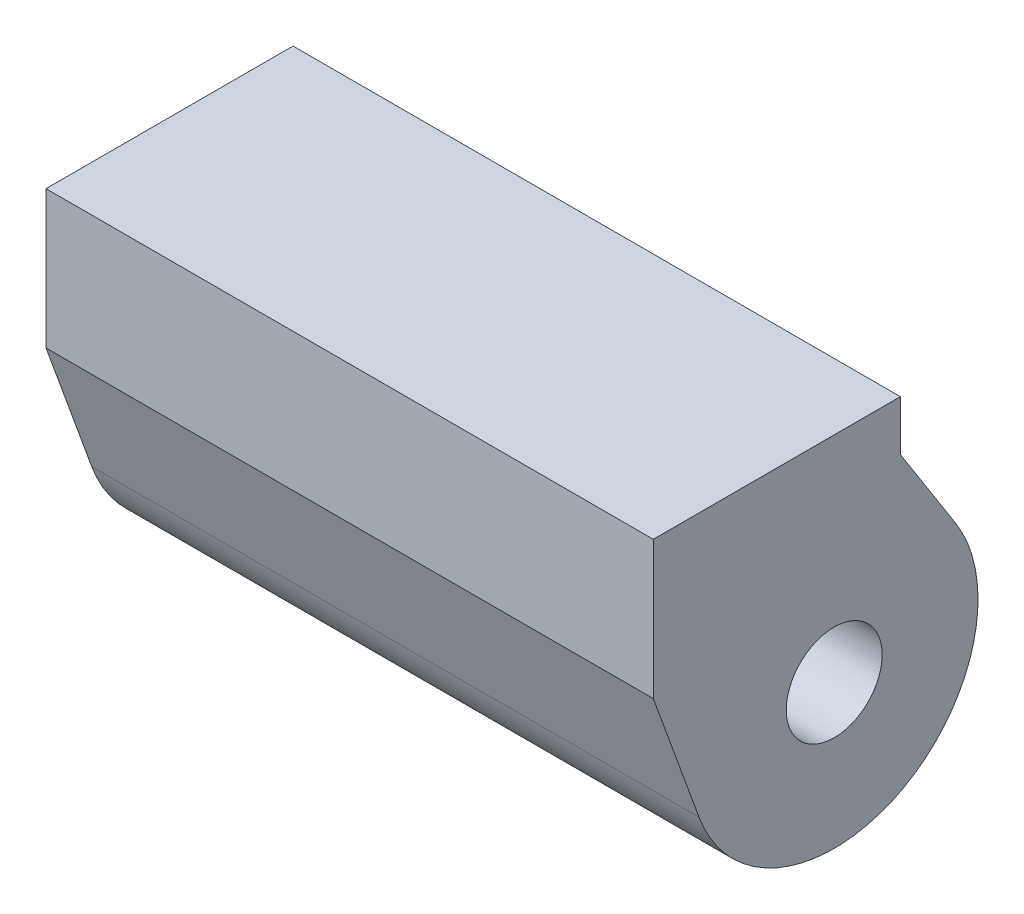
from build123d import *

# Parameters (mm, degrees)
BOSS_EXTRUDE1_START       = -0.8
BOSS_EXTRUDE1_OUTLINE_R   = 6
BOSS_EXTRUDE1_OUTLINE_R_2 = 2.5
BOSS_EXTRUDE1_DEPTH       = 1
BOSS_EXTRUDE1_START_2     = -9.5
BOSS_EXTRUDE1_2_OUTLINE_R = 2.75
BOSS_EXTRUDE1_2_DEPTH     = 19
BOSS_EXTRUDE1_START_3     = 20.214309477
BOSS_EXTRUDE1_3_OUTLINE_R = 1.25
BOSS_EXTRUDE1_3_DEPTH     = 5
SKETCH2_R                 = 6.25
CUT_EXTRUDE1_DEPTH        = 36.290497761
SKETCH3_R                 = 1.5
CUT_EXTRUDE2_DEPTH        = 10
SKETCH4_R                 = 2.75
SKETCH4_R_2               = 1.5
BOSS_EXTRUDE2_DEPTH       = 19
SKETCH5_W                 = 25.593794746
SKETCH5_H                 = 54.341869273
CUT_EXTRUDE3_DEPTH        = 45.112349032
SKETCH6_W                 = 19
SKETCH6_H                 = 8.728279904
BOSS_EXTRUDE3_DEPTH       = 1.568762114
SKETCH7_W                 = 4.505283746
SKETCH7_H                 = 5.968681608
CUT_EXTRUDE4_DEPTH        = 40.377309908


with BuildPart() as part:
    # Boss-Extrude1: read off the stored shape, not the designer's step
    # Boss-Extrude1 outline → Boss-Extrude1 (new body)
    with BuildSketch(Plane(origin=(0, 0, 24.414309477), x_dir=(-1, 0, 0), z_dir=(0, 0, -1)).offset(BOSS_EXTRUDE1_START)):
        with Locations((0, 13.101553709)):
            Circle(BOSS_EXTRUDE1_OUTLINE_R)
        with Locations((0, 13.101553709)):
            Circle(BOSS_EXTRUDE1_OUTLINE_R_2, mode=Mode.SUBTRACT)
    extrude(amount=BOSS_EXTRUDE1_DEPTH)

    # Boss-Extrude1 2 outline → Boss-Extrude1 2 (add)
    with BuildSketch(Plane.YZ.offset(BOSS_EXTRUDE1_START_2)):
        with BuildLine():
            Line((30.808082296, 25.214309477), (-4.594884555, 25.214309477))
            ThreePointArc((-4.594884555, 25.214309477), (-6.157718154, 25.077579254), (-7.673065845, 24.671543064))
            Line((-7.673065845, 24.671543064), (-24.384342131, 18.58913592))
            ThreePointArc((-24.384342131, 18.58913592), (-26.882991431, 12.373899853), (-20.43432651, 10.560855883))
            Line((-20.43432651, 10.560855883), (-7.673065845, 18.658005573))
            ThreePointArc((-7.673065845, 18.658005573), (-5.104992299, 19.817354852), (-2.315454789, 20.214309477))
            Line((-2.315454789, 20.214309477), (30.808082296, 20.214309477))
            Line((30.808082296, 20.214309477), (30.808082296, 25.214309477))
        make_face()
        with Locations((-22.845251486, 14.360519126)):
            Circle(BOSS_EXTRUDE1_2_OUTLINE_R, mode=Mode.SUBTRACT)
    extrude(amount=BOSS_EXTRUDE1_2_DEPTH)

    # Boss-Extrude1 3 outline → Boss-Extrude1 3 (cut)
    with BuildSketch(Plane.XY.offset(BOSS_EXTRUDE1_START_3)):
        with BuildLine():
            ThreePointArc((-9.5, 25.808082296), (-8.035533906, 29.343616202), (-4.5, 30.808082296))
            Line((-4.5, 30.808082296), (-9.5, 30.808082296))
            Line((-9.5, 30.808082296), (-9.5, 25.808082296))
        make_face()
        with BuildLine():
            Line((9.5, 30.808082296), (4.5, 30.808082296))
            ThreePointArc((4.5, 30.808082296), (8.035533906, 29.343616202), (9.5, 25.808082296))
            Line((9.5, 25.808082296), (9.5, 30.808082296))
        make_face()
        with Locations((5, 26.808082296)):
            Circle(BOSS_EXTRUDE1_3_OUTLINE_R)
        with Locations((-5, 26.808082296)):
            Circle(BOSS_EXTRUDE1_3_OUTLINE_R)
    extrude(amount=BOSS_EXTRUDE1_3_DEPTH, mode=Mode.SUBTRACT)

    # Boss-Extrude1 4 outline → Boss-Extrude1 4 (revolve, cut)
    with BuildSketch(Plane.XZ.offset(-13.101553709)):
        Polygon((6, 20.714309477), (6, 24.214309477), (2.5, 24.214309477), (2.5, 25.214309477), (0, 25.214309477), (0, 20.214309477), (6.5, 20.214309477), align=None)
    revolve(axis=Axis((0, 13.101553709, 0), (0, 0, 1)), mode=Mode.SUBTRACT)

    # Sketch2 → Cut-Extrude1 (cut, through all)
    with BuildSketch(Plane(origin=(0, 0, 24.214309477), x_dir=(-1, 0, 0), z_dir=(0, 0, -1))):
        with Locations((0, 13.101553709)):
            Circle(SKETCH2_R)
    extrude(amount=CUT_EXTRUDE1_DEPTH, mode=Mode.SUBTRACT)

    # Sketch3 → Cut-Extrude2 (cut)
    with BuildSketch(Plane.XY.offset(25.214309477)):
        with Locations((-5, 26.808082296)):
            Circle(SKETCH3_R)
        with Locations((5, 26.808082296)):
            Circle(SKETCH3_R)
    extrude(amount=-CUT_EXTRUDE2_DEPTH, mode=Mode.SUBTRACT)

    # Sketch4 → Boss-Extrude2 (add)
    with BuildSketch(Plane.ZY.offset(9.5)):
        with Locations((14.360519126, -22.845251486)):
            Circle(SKETCH4_R)
        with Locations((14.360519126, -22.845251486)):
            Circle(SKETCH4_R_2, mode=Mode.SUBTRACT)
    extrude(amount=-BOSS_EXTRUDE2_DEPTH)

    # Sketch5 → Cut-Extrude3 (cut, through all)
    with BuildSketch(Plane(origin=(9.5, 0, 0), x_dir=(0, 0, -1), z_dir=(1, 0, 0))):
        with Locations((-21.9386431, 9.463333989)):
            Rectangle(SKETCH5_W, SKETCH5_H)
    extrude(amount=-CUT_EXTRUDE3_DEPTH, mode=Mode.SUBTRACT)

    # Sketch6 → Boss-Extrude3 (add)
    with BuildSketch(Plane(origin=(0, -17.707600648, 0), x_dir=(1, 0, 0), z_dir=(0, 1, 0))):
        with Locations((0, -16.655131129)):
            Rectangle(SKETCH6_W, SKETCH6_H)
    extrude(amount=BOSS_EXTRUDE3_DEPTH)

    # Sketch7 → Cut-Extrude4 (cut, through all)
    with BuildSketch(Plane(origin=(9.5, 0, 0), x_dir=(0, 0, -1), z_dir=(1, 0, 0))):
        with Locations((-22.271912954, -19.123179338)):
            Rectangle(SKETCH7_W, SKETCH7_H)
    extrude(amount=-CUT_EXTRUDE4_DEPTH, mode=Mode.SUBTRACT)


solid = part.part
